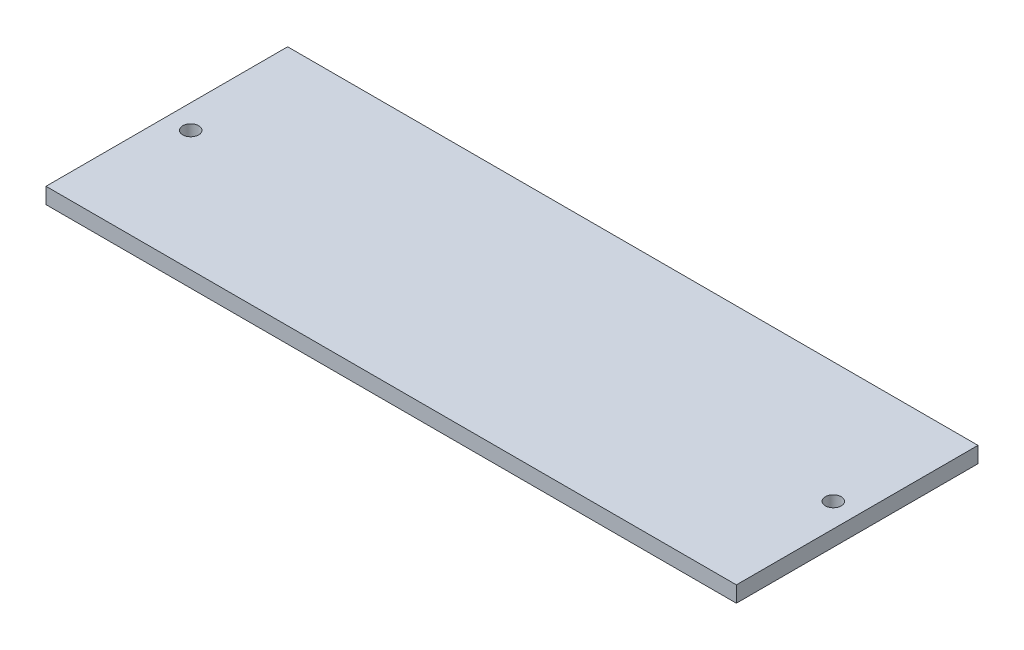
from build123d import *

# Parameters (mm, degrees)
SKETCH1_W           = 130
SKETCH1_H           = 45.5
SKETCH1_R           = 1.5
BOSS_EXTRUDE1_DEPTH = 3


with BuildPart() as part:
    # Sketch1 → Boss-Extrude1 (new body)
    with BuildSketch(Plane(origin=(0, 0, 0), x_dir=(1, 0, 0), z_dir=(0, 1, 0))):
        Rectangle(SKETCH1_W, SKETCH1_H)
        with Locations((60.5, 0)):
            Circle(SKETCH1_R, mode=Mode.SUBTRACT)
        with Locations((-60.5, 0)):
            Circle(SKETCH1_R, mode=Mode.SUBTRACT)
    extrude(amount=BOSS_EXTRUDE1_DEPTH)


solid = part.part
